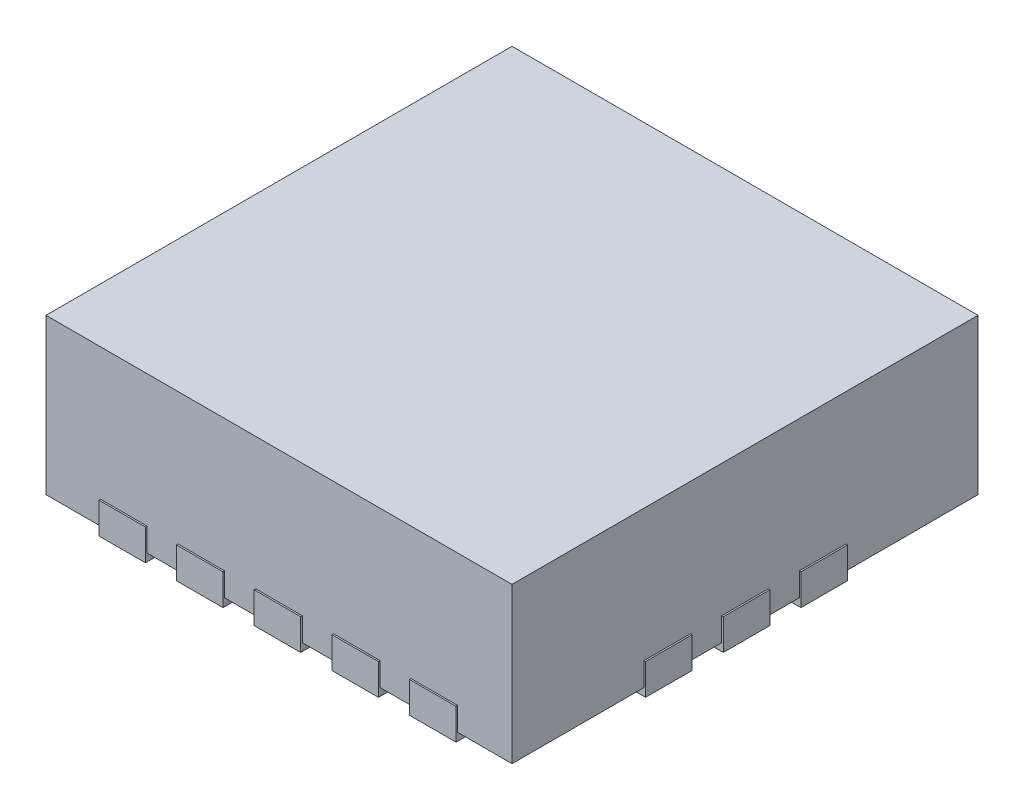
from build123d import *

# Parameters (mm, degrees)
SKETCH1_W           = 3
SKETCH1_H           = 3
BOSS_EXTRUDE1_DEPTH = 1
BOSS_EXTRUDE2_START = 0.05
BOSS_EXTRUDE2_DEPTH = 0.2
LPATTERN1_START     = -0.05
LPATTERN1_DEPTH     = 0.2
LPATTERN1_2_DEPTH   = 0.2
LPATTERN1_3_DEPTH   = 0.2
LPATTERN1_4_DEPTH   = 0.2
LPATTERN1_5_DEPTH   = 0.2
LPATTERN1_6_DEPTH   = 0.2
LPATTERN1_7_DEPTH   = 0.2
BOSS_EXTRUDE4_START = 0.05
BOSS_EXTRUDE4_DEPTH = 0.2
LPATTERN3_START     = -0.05
LPATTERN3_DEPTH     = 0.2
LPATTERN3_2_DEPTH   = 0.2
LPATTERN3_3_DEPTH   = 0.2


# Read off the part's stored shape, not the designer's step: LPattern1, LPattern3
with BuildPart() as part:
    # Sketch1 → Boss-Extrude1 (new body)
    with BuildSketch(Plane(origin=(0, 0, 0), x_dir=(1, 0, 0), z_dir=(0, 1, 0))):
        with Locations((1.5, 1.5)):
            Rectangle(SKETCH1_W, SKETCH1_H)
    extrude(amount=BOSS_EXTRUDE1_DEPTH)


with BuildPart() as body_2:
    # Sketch2 → Boss-Extrude2 (new body)
    with BuildSketch(Plane.XZ.offset(BOSS_EXTRUDE2_START)):
        with BuildLine():
            Line((2.15, 0.01), (2.15, -0.4))
            ThreePointArc((2.15, -0.4), (2, -0.5), (1.85, -0.4))
            Line((1.85, -0.4), (1.85, 0.01))
            Line((1.85, 0.01), (2.15, 0.01))
        make_face()
    boss_extrude2 = extrude(amount=-BOSS_EXTRUDE2_DEPTH)


with BuildPart() as body_3:
    # LPattern1 outline → LPattern1 (new body)
    with BuildSketch(Plane(origin=(0, 0, 0), x_dir=(1, 0, 0), z_dir=(0, 1, 0)).offset(LPATTERN1_START)):
        with BuildLine():
            ThreePointArc((1.15, 0.4), (1, 0.5), (0.85, 0.4))
            Line((0.85, 0.4), (0.85, -0.01))
            Line((0.85, -0.01), (1.15, -0.01))
            Line((1.15, -0.01), (1.15, 0.4))
        make_face()
    lpattern1 = extrude(amount=LPATTERN1_DEPTH)


with BuildPart() as body_4:
    # LPattern1 2 outline → LPattern1 2 (new body)
    with BuildSketch(Plane(origin=(0, 0, 0), x_dir=(1, 0, 0), z_dir=(0, 1, 0)).offset(LPATTERN1_START)):
        with BuildLine():
            ThreePointArc((1.65, 0.4), (1.5, 0.5), (1.35, 0.4))
            Line((1.35, 0.4), (1.35, -0.01))
            Line((1.35, -0.01), (1.65, -0.01))
            Line((1.65, -0.01), (1.65, 0.4))
        make_face()
    lpattern1_2 = extrude(amount=LPATTERN1_2_DEPTH)


with BuildPart() as body_5:
    # LPattern1 3 outline → LPattern1 3 (new body)
    with BuildSketch(Plane(origin=(0, 0, 0), x_dir=(1, 0, 0), z_dir=(0, 1, 0)).offset(LPATTERN1_START)):
        with BuildLine():
            ThreePointArc((2.65, 0.4), (2.5, 0.5), (2.35, 0.4))
            Line((2.35, 0.4), (2.35, -0.01))
            Line((2.35, -0.01), (2.65, -0.01))
            Line((2.65, -0.01), (2.65, 0.4))
        make_face()
    lpattern1_3 = extrude(amount=LPATTERN1_3_DEPTH)


with BuildPart() as body_6:
    # LPattern1 4 outline → LPattern1 4 (new body)
    with BuildSketch(Plane(origin=(0, 0, 0), x_dir=(1, 0, 0), z_dir=(0, 1, 0)).offset(LPATTERN1_START)):
        with BuildLine():
            ThreePointArc((0.65, 0.4), (0.5, 0.5), (0.35, 0.4))
            Line((0.35, 0.4), (0.35, -0.01))
            Line((0.35, -0.01), (0.65, -0.01))
            Line((0.65, -0.01), (0.65, 0.4))
        make_face()
    lpattern1_4 = extrude(amount=LPATTERN1_4_DEPTH)


with BuildPart() as body_7:
    # LPattern1 5 outline → LPattern1 5 (new body)
    with BuildSketch(Plane(origin=(0, 0, 0), x_dir=(1, 0, 0), z_dir=(0, 1, 0)).offset(LPATTERN1_START)):
        with BuildLine():
            ThreePointArc((1.15, 0.4), (1, 0.5), (0.85, 0.4))
            Line((0.85, 0.4), (0.85, -0.01))
            Line((0.85, -0.01), (1.15, -0.01))
            Line((1.15, -0.01), (1.15, 0.4))
        make_face()
    lpattern1_5 = extrude(amount=LPATTERN1_5_DEPTH)


with BuildPart() as body_8:
    # LPattern1 6 outline → LPattern1 6 (new body)
    with BuildSketch(Plane(origin=(0, 0, 0), x_dir=(1, 0, 0), z_dir=(0, 1, 0)).offset(LPATTERN1_START)):
        with BuildLine():
            ThreePointArc((1.65, 0.4), (1.5, 0.5), (1.35, 0.4))
            Line((1.35, 0.4), (1.35, -0.01))
            Line((1.35, -0.01), (1.65, -0.01))
            Line((1.65, -0.01), (1.65, 0.4))
        make_face()
    lpattern1_6 = extrude(amount=LPATTERN1_6_DEPTH)


with BuildPart() as body_9:
    # LPattern1 7 outline → LPattern1 7 (new body)
    with BuildSketch(Plane(origin=(0, 0, 0), x_dir=(1, 0, 0), z_dir=(0, 1, 0)).offset(LPATTERN1_START)):
        with BuildLine():
            ThreePointArc((2.15, 0.4), (2, 0.5), (1.85, 0.4))
            Line((1.85, 0.4), (1.85, -0.01))
            Line((1.85, -0.01), (2.15, -0.01))
            Line((2.15, -0.01), (2.15, 0.4))
        make_face()
    lpattern1_7 = extrude(amount=LPATTERN1_7_DEPTH)


with BuildPart() as body_10:
    # Sketch5 → Boss-Extrude4 (new body)
    with BuildSketch(Plane.XZ.offset(BOSS_EXTRUDE4_START)):
        with BuildLine():
            Line((-0.01, -0.85), (0.4, -0.85))
            ThreePointArc((0.4, -0.85), (0.5, -1), (0.4, -1.15))
            Line((0.4, -1.15), (-0.01, -1.15))
            Line((-0.01, -1.15), (-0.01, -0.85))
        make_face()
    boss_extrude4 = extrude(amount=-BOSS_EXTRUDE4_DEPTH)


with BuildPart() as body_11:
    # LPattern3 outline → LPattern3 (new body)
    with BuildSketch(Plane(origin=(0, 0, 0), x_dir=(1, 0, 0), z_dir=(0, 1, 0)).offset(LPATTERN3_START)):
        with BuildLine():
            ThreePointArc((0.4, 1.85), (0.5, 2), (0.4, 2.15))
            Line((0.4, 2.15), (-0.01, 2.15))
            Line((-0.01, 2.15), (-0.01, 1.85))
            Line((-0.01, 1.85), (0.4, 1.85))
        make_face()
    lpattern3 = extrude(amount=LPATTERN3_DEPTH)


with BuildPart() as body_12:
    # LPattern3 2 outline → LPattern3 2 (new body)
    with BuildSketch(Plane(origin=(0, 0, 0), x_dir=(1, 0, 0), z_dir=(0, 1, 0)).offset(LPATTERN3_START)):
        with BuildLine():
            ThreePointArc((0.4, 1.35), (0.5, 1.5), (0.4, 1.65))
            Line((0.4, 1.65), (-0.01, 1.65))
            Line((-0.01, 1.65), (-0.01, 1.35))
            Line((-0.01, 1.35), (0.4, 1.35))
        make_face()
    lpattern3_2 = extrude(amount=LPATTERN3_2_DEPTH)


with BuildPart() as body_13:
    # LPattern3 3 outline → LPattern3 3 (new body)
    with BuildSketch(Plane(origin=(0, 0, 0), x_dir=(1, 0, 0), z_dir=(0, 1, 0)).offset(LPATTERN3_START)):
        with BuildLine():
            ThreePointArc((0.4, 1.35), (0.5, 1.5), (0.4, 1.65))
            Line((0.4, 1.65), (-0.01, 1.65))
            Line((-0.01, 1.65), (-0.01, 1.35))
            Line((-0.01, 1.35), (0.4, 1.35))
        make_face()
    lpattern3_3 = extrude(amount=LPATTERN3_3_DEPTH)


with BuildPart() as part_1:
    add(part.part)

    # Mirror7: Boss-Extrude4, LPattern3, LPattern3 2, LPattern3 3 across plane
    add(boss_extrude4.mirror(Plane(origin=(1.5, 0, 0), x_dir=(0, 0, 1), z_dir=(1, 0, 0))))
    add(lpattern3.mirror(Plane(origin=(1.5, 0, 0), x_dir=(0, 0, 1), z_dir=(1, 0, 0))))
    add(lpattern3_2.mirror(Plane(origin=(1.5, 0, 0), x_dir=(0, 0, 1), z_dir=(1, 0, 0))))
    add(lpattern3_3.mirror(Plane(origin=(1.5, 0, 0), x_dir=(0, 0, 1), z_dir=(1, 0, 0))))

    # Mirror8: Boss-Extrude2, LPattern1, LPattern1 2, LPattern1 3, LPattern1 4, LPattern1 5, LPattern1 6, LPattern1 7 across plane
    add(boss_extrude2.mirror(Plane.XY.offset(-1.5)))
    add(lpattern1.mirror(Plane.XY.offset(-1.5)))
    add(lpattern1_2.mirror(Plane.XY.offset(-1.5)))
    add(lpattern1_3.mirror(Plane.XY.offset(-1.5)))
    add(lpattern1_4.mirror(Plane.XY.offset(-1.5)))
    add(lpattern1_5.mirror(Plane.XY.offset(-1.5)))
    add(lpattern1_6.mirror(Plane.XY.offset(-1.5)))
    add(lpattern1_7.mirror(Plane.XY.offset(-1.5)))


solid = Compound([body_2.part, body_3.part, body_4.part, body_5.part, body_6.part, body_7.part, body_8.part, body_9.part, body_10.part, body_11.part, body_12.part, body_13.part, part_1.part])
